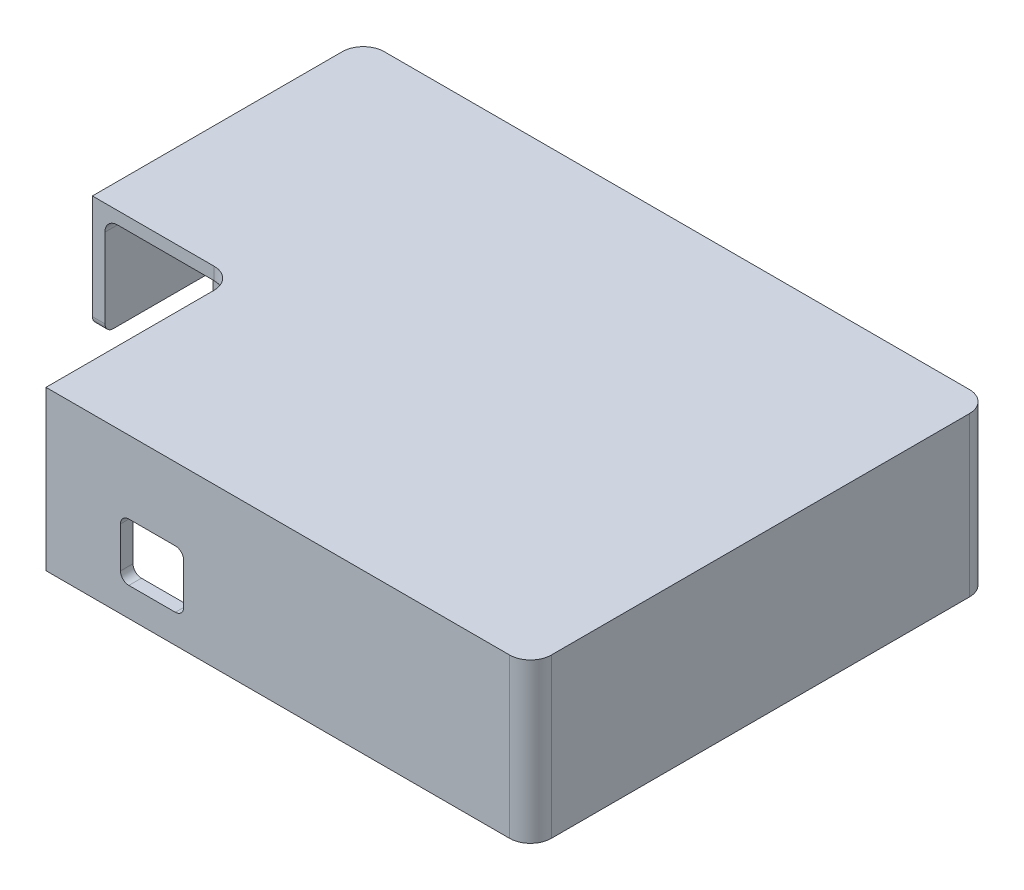
from build123d import *

# Parameters (mm, degrees)
SKETCH1_W           = 150
SKETCH1_H           = 110
BOSS_EXTRUDE1_DEPTH = 38
SKETCH3_W           = 144
SKETCH3_H           = 104
CUT_EXTRUDE1_DEPTH  = 35
CUT_EXTRUDE2_REACH  = 191.853
SKETCH5_W           = 10.5
SKETCH5_H           = 8.5
FILLET4_R           = 3
CUT_EXTRUDE3_REACH  = 191.853
SKETCH6_W           = 34.1
SKETCH6_H           = 45.2
CUT_EXTRUDE4_REACH  = 191.853
SKETCH10_W          = 15.12
SKETCH10_H          = 13.75
FILLET5_R           = 2
BOSS_EXTRUDE2_REACH = 191.853
SKETCH12_W          = 9
SKETCH12_H          = 6
SKETCH13_R          = 2.032
CUT_EXTRUDE5_DEPTH  = 35
CUT_EXTRUDE6_REACH  = 191.853
SKETCH14_W          = 28.8
SKETCH14_H          = 11
FILLET6_R           = 5
FILLET7_R           = 2
FILLET8_DEPTH       = 35
FILLET8_2_DEPTH     = 36
FILLET9_R           = 3


with BuildPart() as part:
    # Sketch1 → Boss-Extrude1 (new body)
    with BuildSketch(Plane(origin=(0, 0, 0), x_dir=(1, 0, 0), z_dir=(0, 1, 0))):
        with Locations((75, 55)):
            Rectangle(SKETCH1_W, SKETCH1_H)
    extrude(amount=BOSS_EXTRUDE1_DEPTH)

    # Sketch3 → Cut-Extrude1 (cut)
    with BuildSketch(Plane.XZ):
        with Locations((75, -55)):
            Rectangle(SKETCH3_W, SKETCH3_H)
    extrude(amount=-CUT_EXTRUDE1_DEPTH, mode=Mode.SUBTRACT)

    # Sketch5 → Cut-Extrude2 (cut, up to next)
    with BuildSketch(Plane.ZY, mode=Mode.PRIVATE) as cut_extrude2_sk1:
        with Locations((-91, 25.27)):
            Rectangle(SKETCH5_W, SKETCH5_H)
    cut_extrude2_tool1 = extrude(cut_extrude2_sk1.sketch, amount=-CUT_EXTRUDE2_REACH, mode=Mode.PRIVATE) & part.part
    add(cut_extrude2_tool1.solids().sort_by_distance((0, 25.27, -91))[0], mode=Mode.SUBTRACT)

    # Fillet4
    fillet4_edges = [part.edges().sort_by_distance(p)[0] for p in [
        (1.5, 21.02, -85.75),
        (1.5, 29.52, -85.75),
        (1.5, 29.52, -96.25),
        (1.5, 21.02, -96.25),
    ]]
    fillet(fillet4_edges, radius=FILLET4_R)

    # Sketch6 → Cut-Extrude3 (cut, up to next)
    with BuildSketch(Plane(origin=(0, 38, 0), x_dir=(1, 0, 0), z_dir=(0, 1, 0)), mode=Mode.PRIVATE) as cut_extrude3_sk1:
        with Locations((17.05, 22.6)):
            Rectangle(SKETCH6_W, SKETCH6_H)
    cut_extrude3_tool1 = extrude(cut_extrude3_sk1.sketch, amount=-CUT_EXTRUDE3_REACH, mode=Mode.PRIVATE) & part.part
    add(cut_extrude3_tool1.solids().sort_by_distance((17.05, 38, -22.6))[0], mode=Mode.SUBTRACT)

    # Sketch10 → Cut-Extrude4 (cut, up to next)
    with BuildSketch(Plane.XY, mode=Mode.PRIVATE) as cut_extrude4_sk1:
        with Locations((59.48, 13.745)):
            Rectangle(SKETCH10_W, SKETCH10_H)
    cut_extrude4_tool1 = extrude(cut_extrude4_sk1.sketch, amount=-CUT_EXTRUDE4_REACH, mode=Mode.PRIVATE) & part.part
    add(cut_extrude4_tool1.solids().sort_by_distance((59.48, 13.745, 0))[0], mode=Mode.SUBTRACT)

    # Fillet5
    fillet5_edges = [part.edges().sort_by_distance(p)[0] for p in [
        (51.92, 6.87, -1.5),
        (51.92, 20.62, -1.5),
        (67.04, 20.62, -1.5),
        (67.04, 6.87, -1.5),
    ]]
    fillet(fillet5_edges, radius=FILLET5_R)

    # Sketch12 → Boss-Extrude2 (add, up to next)
    with BuildSketch(Plane.XZ, mode=Mode.PRIVATE) as boss_extrude2_sk1:
        with Locations((125, -6)):
            Rectangle(SKETCH12_W, SKETCH12_H)
    boss_extrude2_tool1 = extrude(boss_extrude2_sk1.sketch, amount=-BOSS_EXTRUDE2_REACH, mode=Mode.PRIVATE) - part.part
    # Sketch12 → Boss-Extrude2 (add, up to next)
    with BuildSketch(Plane.XZ, mode=Mode.PRIVATE) as boss_extrude2_sk2:
        with Locations((30, -104)):
            Rectangle(SKETCH12_W, SKETCH12_H)
    boss_extrude2_tool2 = extrude(boss_extrude2_sk2.sketch, amount=-BOSS_EXTRUDE2_REACH, mode=Mode.PRIVATE) - part.part
    # Sketch12 → Boss-Extrude2 (add, up to next)
    with BuildSketch(Plane.XZ, mode=Mode.PRIVATE) as boss_extrude2_sk3:
        with Locations((125, -104)):
            Rectangle(SKETCH12_W, SKETCH12_H)
    boss_extrude2_tool3 = extrude(boss_extrude2_sk3.sketch, amount=-BOSS_EXTRUDE2_REACH, mode=Mode.PRIVATE) - part.part
    add(boss_extrude2_tool1.solids().sort_by_distance((125, 0, -6))[0])
    add(boss_extrude2_tool2.solids().sort_by_distance((30, 0, -104))[0])
    add(boss_extrude2_tool3.solids().sort_by_distance((125, 0, -104))[0])

    # Sketch13 → Cut-Extrude5 (cut)
    with BuildSketch(Plane.XZ):
        with Locations(Location((125, -5, 0), (0, 0, 270))):
            Circle(SKETCH13_R)
        with Locations(Location((125, -105, 0), (0, 0, 270))):
            Circle(SKETCH13_R)
        with Locations(Location((30, -105, 0), (0, 0, 270))):
            Circle(SKETCH13_R)
    extrude(amount=-CUT_EXTRUDE5_DEPTH, mode=Mode.SUBTRACT)

    # Sketch14 → Cut-Extrude6 (cut, up to next)
    with BuildSketch(Plane.ZY, mode=Mode.PRIVATE) as cut_extrude6_sk1:
        with Locations((-59.6, 5.5)):
            Rectangle(SKETCH14_W, SKETCH14_H)
    cut_extrude6_tool1 = extrude(cut_extrude6_sk1.sketch, amount=-CUT_EXTRUDE6_REACH, mode=Mode.PRIVATE) & part.part
    add(cut_extrude6_tool1.solids().sort_by_distance((0, 5.5, -59.6))[0], mode=Mode.SUBTRACT)

    # Fillet6
    fillet6_edges = [part.edges().sort_by_distance(p)[0] for p in [
        (147, 17.5, -3),
        (147, 17.5, -107),
        (3, 17.5, -107),
        (34.1, 36.5, -45.2),
        (0, 19, -110),
        (150, 19, -110),
        (150, 19, 0),
    ]]
    fillet(fillet6_edges, radius=FILLET6_R)

    # Fillet7
    fillet7_edges = [part.edges().sort_by_distance(p)[0] for p in [
        (1.5, 11, -74),
        (1.5, 11, -45.2),
    ]]
    fillet(fillet7_edges, radius=FILLET7_R)

    # Fillet8: read off the stored shape, not the designer's step
    # Fillet8 outline → Fillet8 (cut)
    with BuildSketch(Plane(origin=(0, 0, 0), x_dir=(1, 0, 0), z_dir=(0, 1, 0))):
        with BuildLine():
            Line((129.5, 101), (129.5, 104))
            ThreePointArc((129.5, 104), (128.621320344, 101.878679656), (126.5, 101))
            Line((126.5, 101), (129.5, 101))
        make_face()
        with BuildLine():
            Line((25.5, 101), (28.5, 101))
            ThreePointArc((28.5, 101), (26.378679656, 101.878679656), (25.5, 104))
            Line((25.5, 104), (25.5, 101))
        make_face()
        with BuildLine():
            Line((34.5, 101), (34.5, 104))
            ThreePointArc((34.5, 104), (33.621320344, 101.878679656), (31.5, 101))
            Line((31.5, 101), (34.5, 101))
        make_face()
        with BuildLine():
            Line((120.5, 101), (123.5, 101))
            ThreePointArc((123.5, 101), (121.378679656, 101.878679656), (120.5, 104))
            Line((120.5, 104), (120.5, 101))
        make_face()
        with BuildLine():
            Line((120.5, 9), (120.5, 6))
            ThreePointArc((120.5, 6), (121.378679656, 8.121320344), (123.5, 9))
            Line((123.5, 9), (120.5, 9))
        make_face()
        with BuildLine():
            Line((129.5, 9), (126.5, 9))
            ThreePointArc((126.5, 9), (128.621320344, 8.121320344), (129.5, 6))
            Line((129.5, 6), (129.5, 9))
        make_face()
    extrude(amount=FILLET8_DEPTH, mode=Mode.SUBTRACT)

    # Fillet8 2 outline → Fillet8 2 (add)
    with BuildSketch(Plane(origin=(0, 0, 0), x_dir=(1, 0, 0), z_dir=(0, 1, 0))):
        with BuildLine():
            Line((129.5, 107), (129.5, 104))
            ThreePointArc((129.5, 104), (130.378679656, 106.121320344), (132.5, 107))
            Line((132.5, 107), (129.5, 107))
        make_face()
        with BuildLine():
            ThreePointArc((22.5, 107), (24.621320344, 106.121320344), (25.5, 104))
            Line((25.5, 104), (25.5, 107))
            Line((25.5, 107), (22.5, 107))
        make_face()
        with BuildLine():
            ThreePointArc((34.5, 104), (35.378679656, 106.121320344), (37.5, 107))
            Line((37.5, 107), (34.5, 107))
            Line((34.5, 107), (34.5, 104))
        make_face()
        with BuildLine():
            ThreePointArc((117.5, 107), (119.621320344, 106.121320344), (120.5, 104))
            Line((120.5, 104), (120.5, 107))
            Line((120.5, 107), (117.5, 107))
        make_face()
        with BuildLine():
            Line((120.5, 3), (120.5, 6))
            ThreePointArc((120.5, 6), (119.621320344, 3.878679656), (117.5, 3))
            Line((117.5, 3), (120.5, 3))
        make_face()
        with BuildLine():
            ThreePointArc((132.5, 3), (130.378679656, 3.878679656), (129.5, 6))
            Line((129.5, 6), (129.5, 3))
            Line((129.5, 3), (132.5, 3))
        make_face()
    extrude(amount=FILLET8_2_DEPTH)

    # Fillet9
    fillet9_edges = [part.edges().sort_by_distance(p)[0] for p in [
        (147, 35, -55),
        (137.25, 35, -3),
        (15.25, 35, -107),
        (4.464466094, 35, -105.535533906),
        (145.535533906, 35, -4.464466094),
        (145.535533906, 35, -105.535533906),
        (125, 35, -101),
        (77.5, 35, -107),
        (137.25, 35, -107),
        (125, 35, -9),
        (75.8, 35, -3),
        (30, 35, -101),
        (24.621320344, 35, -106.121320344),
        (130.378679656, 35, -106.121320344),
        (130.378679656, 35, -3.878679656),
        (119.621320344, 35, -3.878679656),
        (35.378679656, 35, -106.121320344),
        (119.621320344, 35, -106.121320344),
        (128.621320344, 35, -101.878679656),
        (121.378679656, 35, -101.878679656),
        (33.621320344, 35, -101.878679656),
        (121.378679656, 35, -8.121320344),
        (128.621320344, 35, -8.121320344),
        (26.378679656, 35, -101.878679656),
        (3, 35, -73.6),
    ]]
    fillet(fillet9_edges, radius=FILLET9_R)


solid = part.part
